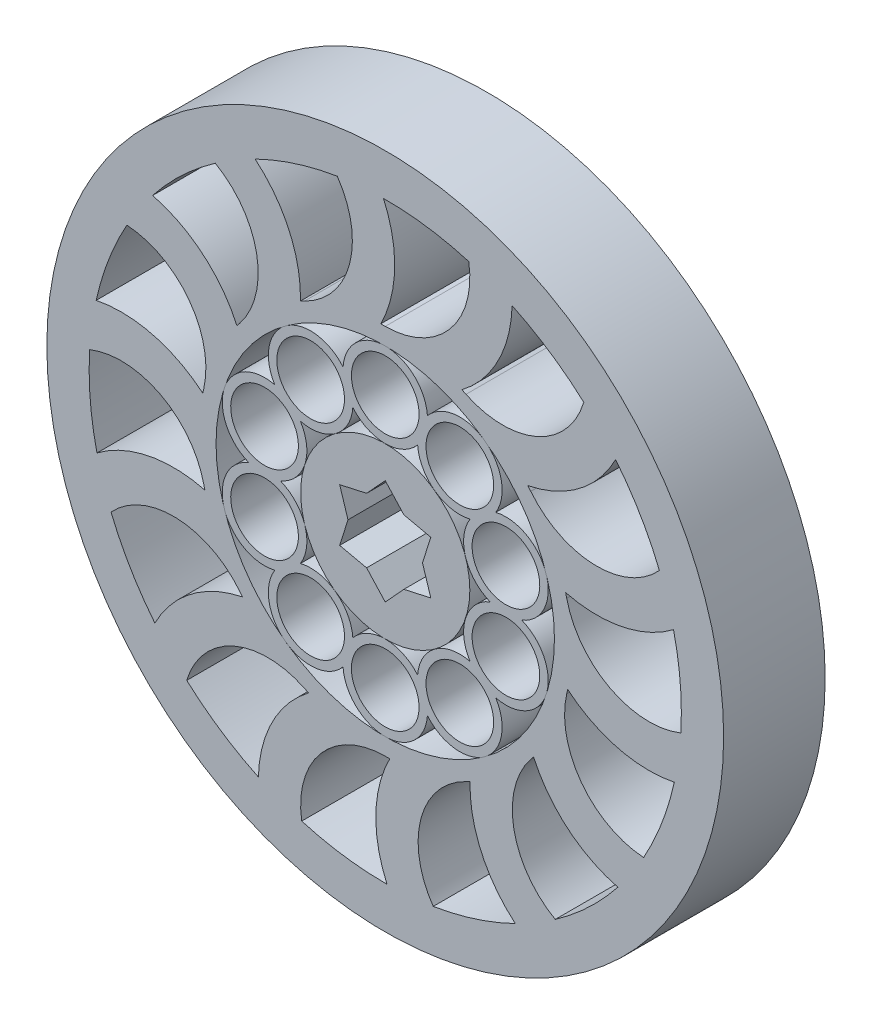
from build123d import *

# Parameters (mm, degrees)
SKETCH2_R           = 10
SKETCH2_R_2         = 1
BOSS_EXTRUDE2_DEPTH = 6
SKETCH3_R           = 5
SKETCH3_R_2         = 4
BOSS_EXTRUDE3_DEPTH = 6
CIRPATTERN1_COUNT   = 10
SKETCH5_R           = 22
SKETCH5_R_2         = 20
BOSS_EXTRUDE4_DEPTH = 6
SKETCH6_R           = 40
SKETCH6_R_2         = 35
BOSS_EXTRUDE5_DEPTH = 6
BOSS_EXTRUDE6_DEPTH = 6
CAVITY1_OUTLINE_R   = 1
CAVITY1_DEPTH       = 6
CUT_EXTRUDE1_DEPTH  = 6


# Read off the part's stored shape, not the designer's step: Cavity1
with BuildPart() as part:
    # Sketch2 → Boss-Extrude2 (new body)
    with BuildSketch(Plane.XY):
        Circle(SKETCH2_R)
        Circle(SKETCH2_R_2, mode=Mode.SUBTRACT)
    extrude(amount=BOSS_EXTRUDE2_DEPTH)

    # Cavity1 outline → Cavity1 (cut)
    with BuildSketch(Plane.XY):
        Polygon((5.127518984, -2.960374466), (4.194116501, 0), (5.127518984, 2.960374466), (2.09705825, 3.632211436), (0, 5.920748932), (-2.09705825, 3.632211436), (-5.127518984, 2.960374466), (-4.194116501, 0), (-5.127518984, -2.960374466), (-2.09705825, -3.632211436), (0, -5.920748932), (2.09705825, -3.632211436), align=None)
        Circle(CAVITY1_OUTLINE_R, mode=Mode.SUBTRACT)
    extrude(amount=CAVITY1_DEPTH, mode=Mode.SUBTRACT)

    # Sketch8 → Cut-Extrude1 (cut)
    # profile 1 of 2: a face of its own
    with BuildSketch(Plane(origin=(0, 0, 0), x_dir=(-1, 0, 0), z_dir=(0, 0, -1))):
        Polygon((5.383894933, -3.108393189), (4.403822326, 0), (5.383894933, 3.108393189), (2.201911163, 3.813822008), (0, 6.216786378), (-2.201911163, 3.813822008), (-5.383894933, 3.108393189), (-4.403822326, 0), (-5.383894933, -3.108393189), (-2.201911163, -3.813822008), (0, -6.216786378), (2.201911163, -3.813822008), align=None)
        Polygon((-2.09705825, -3.632211436), (-5.127518984, -2.960374466), (-4.194116501, 0), (-5.127518984, 2.960374466), (-2.09705825, 3.632211436), (0, 5.920748932), (2.09705825, 3.632211436), (5.127518984, 2.960374466), (4.194116501, 0), (5.127518984, -2.960374466), (2.09705825, -3.632211436), (0, -5.920748932), align=None, mode=Mode.SUBTRACT)
    # profile 2 of 2: a face of its own
    with BuildSketch(Plane(origin=(0, 0, 0), x_dir=(-1, 0, 0), z_dir=(0, 0, -1))):
        Polygon((-5.127518984, -2.960374466), (-4.194116501, 0), (-5.127518984, 2.960374466), (-2.09705825, 3.632211436), (0, 5.920748932), (2.09705825, 3.632211436), (5.127518984, 2.960374466), (4.194116501, 0), (5.127518984, -2.960374466), (2.09705825, -3.632211436), (0, -5.920748932), (-2.09705825, -3.632211436), align=None)
    extrude(amount=-CUT_EXTRUDE1_DEPTH, mode=Mode.SUBTRACT)

    # Mirror1: part across plane


with BuildPart() as body_2:
    # Sketch3 → Boss-Extrude3 (new body)
    with BuildSketch(Plane.XY):
        with Locations((0, 15)):
            Circle(SKETCH3_R)
        with Locations((0, 15)):
            Circle(SKETCH3_R_2, mode=Mode.SUBTRACT)
    boss_extrude3 = extrude(amount=BOSS_EXTRUDE3_DEPTH)

    # CirPattern1: Boss-Extrude3 ×10 about axis
    cirpattern1_axis = Axis((0, 0, 0), (0, 0, 1))
    for i in range(1, CIRPATTERN1_COUNT):
        add(boss_extrude3.rotate(cirpattern1_axis, i * 360 / CIRPATTERN1_COUNT))

    # Mirror1 2: body 2 across plane


with BuildPart() as body_3:
    # Sketch5 → Boss-Extrude4 (new body)
    with BuildSketch(Plane.XY):
        Circle(SKETCH5_R)
        Circle(SKETCH5_R_2, mode=Mode.SUBTRACT)
    extrude(amount=BOSS_EXTRUDE4_DEPTH)



with BuildPart() as body_4:
    # Sketch6 → Boss-Extrude5 (new body)
    with BuildSketch(Plane.XY):
        Circle(SKETCH6_R)
        Circle(SKETCH6_R_2, mode=Mode.SUBTRACT)
    extrude(amount=BOSS_EXTRUDE5_DEPTH)


with BuildPart() as body_3_1:
    add(body_3.part)

    add(body_4.part)  # Boss-Extrude6 merges body 4
    # Sketch7 → Boss-Extrude6 (add)
    with BuildSketch(Plane.XY):
        with BuildLine():
            ThreePointArc((0, 22), (7.608588897, 25.510826324), (9.874690956, 33.578125))
            ThreePointArc((9.874690956, 33.578125), (12.473288788, 32.70194286), (14.995311767, 31.625))
            ThreePointArc((14.995311767, 31.625), (13.349298508, 25.159223045), (9.062163248, 20.046875))
            ThreePointArc((9.062163248, 20.046875), (4.635124054, 21.506176438), (0, 22))
        make_face()
        with BuildLine():
            ThreePointArc((16.862740045, 14.129684999), (13.507282719, 17.365290483), (9.545442261, 19.821315094))
            ThreePointArc((9.545442261, 19.821315094), (17.923834438, 19.683217312), (23.465791559, 25.968377433))
            ThreePointArc((23.465791559, 25.968377433), (25.426886123, 24.051475258), (27.231882316, 21.986918509))
            ThreePointArc((27.231882316, 21.986918509), (22.943480132, 16.875633153), (16.862740045, 14.129684999))
        make_face()
        with BuildLine():
            ThreePointArc((21.323444368, 5.413937595), (19.704158385, 9.784995775), (17.200292614, 13.716775641))
            ThreePointArc((17.200292614, 13.716775641), (24.689044747, 9.957105713), (32.409204355, 13.215274234))
            ThreePointArc((32.409204355, 13.215274234), (33.344376821, 10.63731801), (34.074844596, 7.994058155))
            ThreePointArc((34.074844596, 7.994058155), (27.993424133, 5.249617149), (21.323444368, 5.413937595))
        make_face()
        with BuildLine():
            ThreePointArc((21.560779019, -4.374106547), (21.998383828, 0.26666265), (21.448414068, 4.895460547))
            ThreePointArc((21.448414068, 4.895460547), (26.564286953, -1.741132788), (34.933576755, -2.155276102))
            ThreePointArc((34.933576755, -2.155276102), (34.657604747, -4.883690529), (34.168866002, -7.582123457))
            ThreePointArc((34.168866002, -7.582123457), (27.498927167, -7.416149914), (21.560779019, -4.374106547))
        make_face()
        with BuildLine():
            ThreePointArc((17.52773696, -13.295805243), (19.935559561, -9.304486284), (21.448414068, -4.895460547))
            ThreePointArc((21.448414068, -4.895460547), (23.178146338, -13.094518587), (30.538925847, -17.098947573))
            ThreePointArc((30.538925847, -17.098947573), (29.106469006, -19.437424263), (27.495324443, -21.65657253))
            ThreePointArc((27.495324443, -21.65657253), (21.557930424, -18.613057533), (17.52773696, -13.295805243))
        make_face()
        with BuildLine():
            ThreePointArc((10.023111632, -19.584106648), (13.924253229, -17.032767597), (17.200292614, -13.716775641))
            ThreePointArc((17.200292614, -13.716775641), (15.20128958, -21.854374387), (20.095666139, -28.655962772))
            ThreePointArc((20.095666139, -28.655962772), (17.790440111, -30.141337738), (15.37599667, -31.441671813))
            ThreePointArc((15.37599667, -31.441671813), (11.34712117, -26.123420834), (10.023111632, -19.584106648))
        make_face()
        with BuildLine():
            ThreePointArc((0.53328612, -21.993535548), (5.155077775, -21.387500395), (9.545442261, -19.821315094))
            ThreePointArc((9.545442261, -19.821315094), (4.213630989, -26.285703312), (5.672213296, -34.537313102))
            ThreePointArc((5.672213296, -34.537313102), (2.950796366, -34.875389615), (0.211264183, -34.999362386))
            ThreePointArc((0.211264183, -34.999362386), (-1.111124596, -28.459720256), (0.53328612, -21.993535548))
        make_face()
        with BuildLine():
            ThreePointArc((-9.062163248, -20.046875), (-4.635124054, -21.506176438), (0, -22))
            ThreePointArc((0, -22), (-7.608588897, -25.510826324), (-9.874690956, -33.578125))
            ThreePointArc((-9.874690956, -33.578125), (-12.473288788, -32.70194286), (-14.995311767, -31.625))
            ThreePointArc((-14.995311767, -31.625), (-13.349298508, -25.159223045), (-9.062163248, -20.046875))
        make_face()
        with BuildLine():
            ThreePointArc((-16.862740045, -14.129684999), (-13.507282719, -17.365290483), (-9.545442261, -19.821315094))
            ThreePointArc((-9.545442261, -19.821315094), (-17.923834438, -19.683217312), (-23.465791559, -25.968377433))
            ThreePointArc((-23.465791559, -25.968377433), (-25.426886123, -24.051475258), (-27.231882316, -21.986918509))
            ThreePointArc((-27.231882316, -21.986918509), (-22.943480132, -16.875633153), (-16.862740045, -14.129684999))
        make_face()
        with BuildLine():
            ThreePointArc((-21.323444368, -5.413937595), (-19.704158385, -9.784995775), (-17.200292614, -13.716775641))
            ThreePointArc((-17.200292614, -13.716775641), (-24.689044747, -9.957105713), (-32.409204355, -13.215274234))
            ThreePointArc((-32.409204355, -13.215274234), (-33.344376821, -10.63731801), (-34.074844596, -7.994058155))
            ThreePointArc((-34.074844596, -7.994058155), (-27.993424133, -5.249617149), (-21.323444368, -5.413937595))
        make_face()
        with BuildLine():
            ThreePointArc((-21.560779019, 4.374106547), (-21.998383828, -0.26666265), (-21.448414068, -4.895460547))
            ThreePointArc((-21.448414068, -4.895460547), (-26.564286953, 1.741132788), (-34.933576755, 2.155276102))
            ThreePointArc((-34.933576755, 2.155276102), (-34.657604747, 4.883690529), (-34.168866002, 7.582123457))
            ThreePointArc((-34.168866002, 7.582123457), (-27.498927167, 7.416149914), (-21.560779019, 4.374106547))
        make_face()
        with BuildLine():
            ThreePointArc((-17.52773696, 13.295805243), (-19.935559561, 9.304486284), (-21.448414068, 4.895460547))
            ThreePointArc((-21.448414068, 4.895460547), (-23.178146338, 13.094518587), (-30.538925847, 17.098947573))
            ThreePointArc((-30.538925847, 17.098947573), (-29.106469006, 19.437424263), (-27.495324443, 21.65657253))
            ThreePointArc((-27.495324443, 21.65657253), (-21.557930424, 18.613057533), (-17.52773696, 13.295805243))
        make_face()
        with BuildLine():
            ThreePointArc((-10.023111632, 19.584106648), (-13.924253229, 17.032767597), (-17.200292614, 13.716775641))
            ThreePointArc((-17.200292614, 13.716775641), (-15.20128958, 21.854374387), (-20.095666139, 28.655962772))
            ThreePointArc((-20.095666139, 28.655962772), (-17.790440111, 30.141337738), (-15.37599667, 31.441671813))
            ThreePointArc((-15.37599667, 31.441671813), (-11.34712117, 26.123420834), (-10.023111632, 19.584106648))
        make_face()
        with BuildLine():
            ThreePointArc((-0.53328612, 21.993535548), (-5.155077775, 21.387500395), (-9.545442261, 19.821315094))
            ThreePointArc((-9.545442261, 19.821315094), (-4.213630989, 26.285703312), (-5.672213296, 34.537313102))
            ThreePointArc((-5.672213296, 34.537313102), (-2.950796366, 34.875389615), (-0.211264183, 34.999362386))
            ThreePointArc((-0.211264183, 34.999362386), (1.111124596, 28.459720256), (-0.53328612, 21.993535548))
        make_face()
    extrude(amount=BOSS_EXTRUDE6_DEPTH)

    # Mirror1 3: body 3 across plane


with BuildPart() as part_1:
    add(part.part)
    add(part.part.mirror(Plane.XY))


with BuildPart() as body_2_1:
    add(body_2.part)
    add(body_2.part.mirror(Plane.XY))


with BuildPart() as body_3_2:
    add(body_3_1.part)
    add(body_3_1.part.mirror(Plane.XY))


solid = Compound([part_1.part, body_2_1.part, body_3_2.part])
